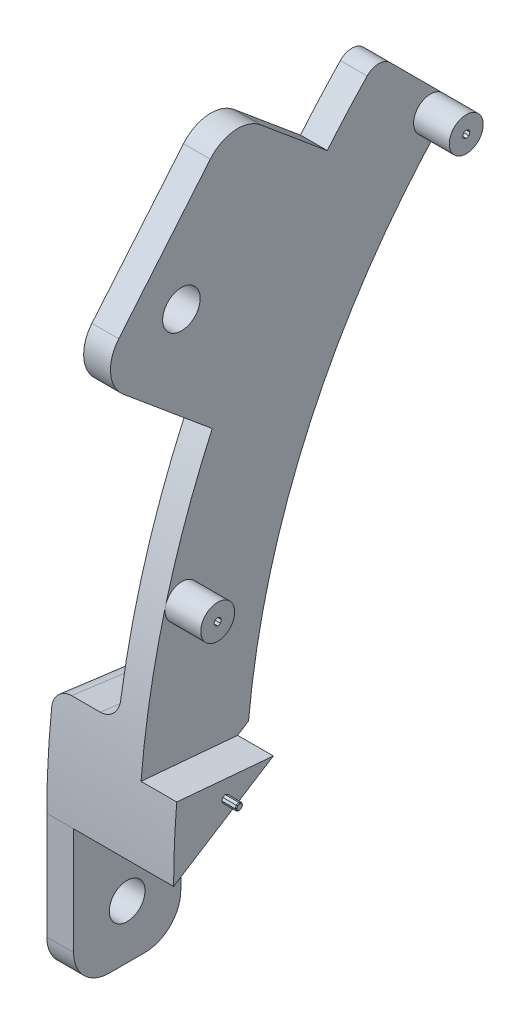
from build123d import *

# Parameters (mm, degrees)
CURVE_MAIN_BODY_DEPTH        = 35.5
CUT_EXTRUDE2_START           = -18
CUT_EXTRUDE2_DEPTH           = 18
CUT_EXTRUDE3_DEPTH           = 10
FILLET3_R                    = 5
FILLET3_OF_MIRROR3_R         = 5
SKETCH14_W                   = 7.5
SKETCH14_H                   = 30
BOSS_EXTRUDE9_DEPTH          = 40
SKETCH17_R                   = 4.75
BOSS_EXTRUDE6_DEPTH          = 25
BOSS_EXTRUDE7_DEPTH          = 7.5
SKETCH21_W                   = 105.177079877
SKETCH21_H                   = 219.768987876
CUT_EXTRUDE5_DEPTH           = 271.966391894
CHAMFER2_SIZE                = 30
SKETCH22_R                   = 5
BICEPS_CONNECTION_HOLE_DEPTH = 271.086163168
SERVO_HOLE_DEPTH             = 270.838443396
SERVO_HOLE_DEPTH_BACK        = 270.838443396
SKETCH19_R                   = 5.25
FEMALE_JACK_DEPTH            = 5
MALE_JACK_DEPTH              = 4
CHAMFER3_SIZE                = 0.2
BICEPS_CONNECTION_FILLET_R   = 10
BOW_CONNECTION_FILLET_R      = 4.5
SERVO_HOLE_FILLET_R          = 10


with BuildPart() as part:
    # Sketch2 → Curve Main Body (new body)
    with BuildSketch(Plane(origin=(0, 0, 0), x_dir=(0, 0, -1), z_dir=(1, 0, 0))):
        with BuildLine():
            Line((-197.17702304, 0), (-167.17702304, 0))
            ThreePointArc((-167.17702304, 0), (-151.952929542, 76.536686473), (-108.598379277, 141.421356237))
            Line((-108.598379277, 141.421356237), (-129.811582713, 162.634559673))
            ThreePointArc((-129.811582713, 162.634559673), (-179.669315518, 88.017189444), (-197.17702304, 0))
        make_face()
    curve_main_body = extrude(amount=CURVE_MAIN_BODY_DEPTH)

    # Sketch6 → Cut-Extrude2 (cut)
    with BuildSketch(Plane(origin=(35.5, 0, 0), x_dir=(0, 0, -1), z_dir=(1, 0, 0)).offset(CUT_EXTRUDE2_START)):
        with BuildLine():
            Line((-165.465995315, 26.105238444), (-195.209341156, 30.021024211))
            ThreePointArc((-195.209341156, 30.021024211), (-173.457753593, 101.72639875), (-129.811582713, 162.634559673))
            Line((-129.811582713, 162.634559673), (-108.598379277, 141.421356237))
            ThreePointArc((-108.598379277, 141.421356237), (-146.551571347, 88.457738044), (-165.465995315, 26.105238444))
        make_face()
    cut_extrude2 = extrude(amount=CUT_EXTRUDE2_DEPTH, mode=Mode.SUBTRACT)

    # Sketch7 → Cut-Extrude3 (cut)
    with BuildSketch(Plane.ZY):
        with BuildLine():
            Line((166.415962658, 17.43114855), (196.301803601, 20.045820832))
            ThreePointArc((196.301803601, 20.045820832), (175.627814058, 97.2022002), (129.811582713, 162.634559673))
            Line((129.811582713, 162.634559673), (108.598379277, 141.421356237))
            ThreePointArc((108.598379277, 141.421356237), (148.438580447, 84.523652348), (166.415962658, 17.43114855))
        make_face()
    cut_extrude3 = extrude(amount=-CUT_EXTRUDE3_DEPTH, mode=Mode.SUBTRACT)

    # Fillet3
    fillet3_edges = [part.edges().sort_by_distance(p)[0] for p in [
        (35.5, 28.063131327, 180.337668235),
        (17.5, 28.063131327, 180.337668235),
    ]]
    fillet(fillet3_edges, radius=FILLET3_R)

    # Mirror3: Curve Main Body, Cut-Extrude2, Cut-Extrude3 across plane
    add(curve_main_body.mirror(Plane(origin=(0, 0, -32.82297696), x_dir=(0, 0, 1), z_dir=(-1, 0, 0))))
    add(cut_extrude2.mirror(Plane(origin=(0, 0, -32.82297696), x_dir=(0, 0, 1), z_dir=(-1, 0, 0))), mode=Mode.SUBTRACT)
    add(cut_extrude3.mirror(Plane(origin=(0, 0, -32.82297696), x_dir=(0, 0, 1), z_dir=(-1, 0, 0))), mode=Mode.SUBTRACT)

    # Fillet3 of Mirror3
    fillet3_of_mirror3_edges = [part.edges().sort_by_distance(p)[0] for p in [
        (-35.5, 28.063131327, 180.337668235),
        (-17.5, 28.063131327, 180.337668235),
    ]]
    fillet(fillet3_of_mirror3_edges, radius=FILLET3_OF_MIRROR3_R)

    # Sketch14 → Boss-Extrude9 (add)
    with BuildSketch(Plane.XZ):
        with Locations((-31.75, 182.17702304)):
            Rectangle(SKETCH14_W, SKETCH14_H)
        with Locations((31.75, 182.17702304)):
            Rectangle(SKETCH14_W, SKETCH14_H)
    extrude(amount=BOSS_EXTRUDE9_DEPTH)

    # Sketch17 → Boss-Extrude6 (add)
    with BuildSketch(Plane(origin=(-10, 0, 0), x_dir=(0, 0, -1), z_dir=(1, 0, 0))):
        with Locations(Location((-115.276928512, 141.382391051, 0), (0, 0, 45))):
            Circle(SKETCH17_R)
        with Locations(Location((-184.833556277, 57.993068891, 0), (0, 0, 165.080977231))):
            Circle(SKETCH17_R)
    extrude(amount=BOSS_EXTRUDE6_DEPTH)

    # Sketch18 → Boss-Extrude7 (add)
    with BuildSketch(Plane(origin=(-10, 0, 0), x_dir=(0, 0, -1), z_dir=(1, 0, 0))):
        Polygon((-208.94151729, 122.761668275), (-162.866051375, 84.329241332), (-124.433624432, 130.404707247), (-170.509090347, 168.83713419), align=None)
    extrude(amount=-BOSS_EXTRUDE7_DEPTH)

    # Sketch21 → Cut-Extrude5 (cut, through all)
    with BuildSketch(Plane(origin=(0, 0, 0), x_dir=(0, 0, -1), z_dir=(1, 0, 0))):
        with Locations((-156.96960977, 61.310905927)):
            Rectangle(SKETCH21_W, SKETCH21_H)
    extrude(amount=CUT_EXTRUDE5_DEPTH, mode=Mode.SUBTRACT)

    # Chamfer2
    # the kernel refuses this chamfer: 30, 19 mm, written as the material it takes off along each edge
    with BuildSketch(Plane(origin=(-28, 0, 167.17702304), x_dir=(0, 0, 1), z_dir=(1, 0, 0))) as chamfer2_piece_1:
        with BuildLine():
            Line((CHAMFER2_SIZE, 0), (-0.963738269, -19.610367571))
            ThreePointArc((-0.963738269, -19.610367571), (-0.258402539, -10.163377571), (0, 0))
            Line((0, 0), (CHAMFER2_SIZE, 0))
        make_face()
    extrude(amount=105.551070811, mode=Mode.SUBTRACT)

    # Sketch22 → Biceps Connection Hole (cut, through all)
    with BuildSketch(Plane(origin=(-28, 0, 0), x_dir=(0, 0, -1), z_dir=(1, 0, 0))):
        with Locations((-182.17702304, -25)):
            Circle(SKETCH22_R)
    extrude(amount=-BICEPS_CONNECTION_HOLE_DEPTH, mode=Mode.SUBTRACT)

    # Sketch19 → Servo Hole (cut, two sides: drawn at the far end of the back side and taken through both)
    with BuildSketch(Plane(origin=(-10, 0, 0), x_dir=(0, 0, -1), z_dir=(1, 0, 0)).offset(-SERVO_HOLE_DEPTH_BACK)):
        with Locations((-184.995804047, 128.832320402)):
            Circle(SKETCH19_R)
    extrude(amount=SERVO_HOLE_DEPTH + SERVO_HOLE_DEPTH_BACK, mode=Mode.SUBTRACT)

    # Sketch23 → Female Jack (cut)
    with BuildSketch(Plane(origin=(0, 0, 0), x_dir=(0, 0, -1), z_dir=(1, 0, 0))):
        Polygon((-115.276928512, 140.357391051), (-114.552144061, 140.6576066), (-114.251928512, 141.382391051), (-114.552144061, 142.107175501), (-115.276928512, 142.407391051), (-116.001712963, 142.107175501), (-116.301928512, 141.382391051), (-116.001712963, 140.6576066), align=None)
        Polygon((-184.833556277, 59.018068891), (-185.558340728, 58.717853341), (-185.858556277, 57.993068891), (-185.558340728, 57.26828444), (-184.833556277, 56.968068891), (-184.108771826, 57.26828444), (-183.808556277, 57.993068891), (-184.108771826, 58.717853341), align=None)
    extrude(amount=-FEMALE_JACK_DEPTH, mode=Mode.SUBTRACT)

    # Sketch25 → Male Jack (add)
    with BuildSketch(Plane(origin=(0, 0, 0), x_dir=(0, 0, -1), z_dir=(1, 0, 0))):
        Polygon((-182.728675304, 15.032130751), (-183.431679202, 14.729522163), (-183.714801441, 14.018446755), (-183.412192854, 13.315442858), (-182.701117446, 13.032320619), (-181.998113548, 13.334929206), (-181.714991309, 14.046004614), (-182.017599897, 14.749008512), align=None)
    extrude(amount=MALE_JACK_DEPTH)

    # Chamfer3
    chamfer3_edges = [part.edges().sort_by_distance(p)[0] for p in [
        (4, 14.890569631, 182.373137601),
        (4, 14.880826457, 183.080177253),
        (4, 14.373984459, 183.573240322),
        (4, 13.666944806, 183.563497147),
        (4, 13.173881738, 183.05665515),
        (4, 13.183624912, 182.349615497),
        (4, 13.69046691, 181.856552429),
        (4, 14.397506563, 181.866295603),
    ]]
    chamfer(chamfer3_edges, length=CHAMFER3_SIZE)

    # Biceps Connection Fillet
    biceps_connection_fillet_edges = [part.edges().sort_by_distance(p)[0] for p in [
        (-31.75, -40, 167.17702304),
        (-31.75, -40, 197.17702304),
    ]]
    fillet(biceps_connection_fillet_edges, radius=BICEPS_CONNECTION_FILLET_R)

    # Bow Connection Fillet
    bow_connection_fillet_edges = [part.edges().sort_by_distance(p)[0] for p in [
        (-13.75, 162.634559673, 129.811582713),
        (-13.75, 141.421356237, 108.598379277),
    ]]
    fillet(bow_connection_fillet_edges, radius=BOW_CONNECTION_FILLET_R)

    # Servo Hole Fillet
    servo_hole_fillet_edges = [part.edges().sort_by_distance(p)[0] for p in [
        (-13.75, 168.83713419, 170.509090347),
        (-13.75, 122.761668275, 208.94151729),
    ]]
    fillet(servo_hole_fillet_edges, radius=SERVO_HOLE_FILLET_R)


solid = part.part
